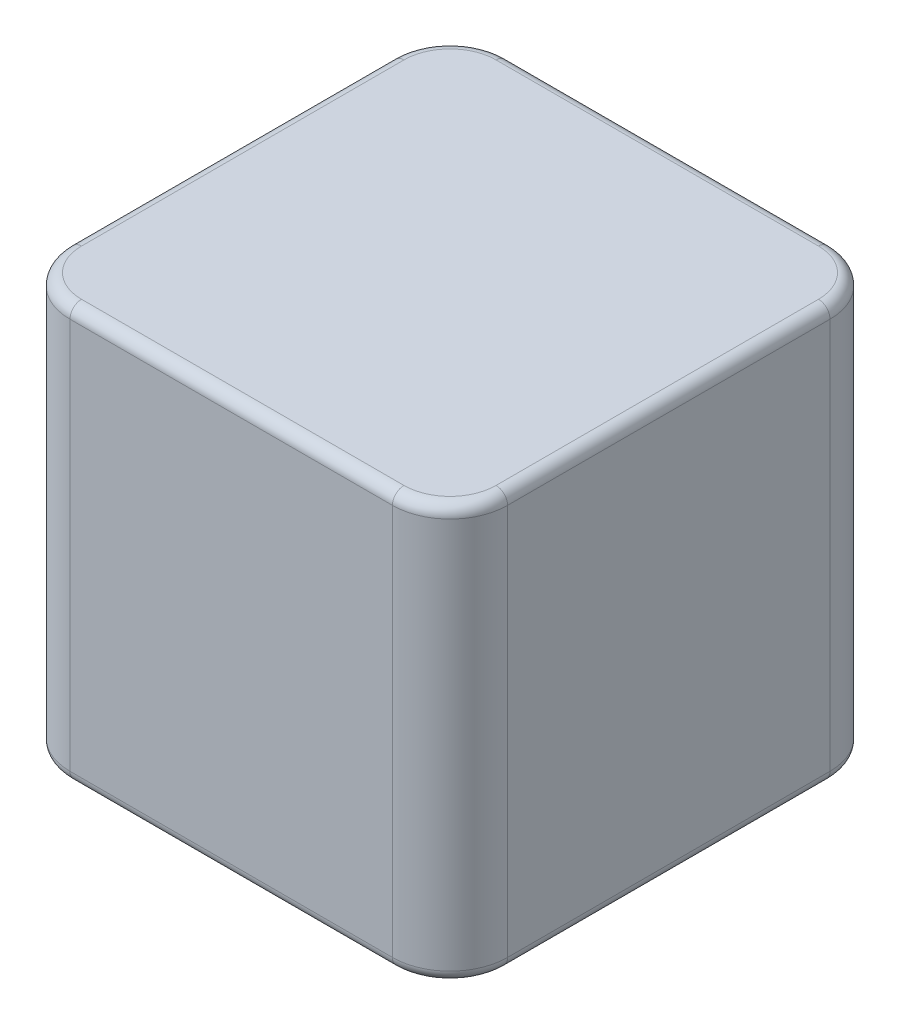
from build123d import *

# Parameters (mm, degrees)
SKETCH1_W           = 38
SKETCH1_H           = 38
BOSS_EXTRUDE1_DEPTH = 36
SKETCH3_R           = 7
CUT_EXTRUDE1_DEPTH  = 2
FILLET1_R           = 5
FILLET2_R           = 1


with BuildPart() as part:
    # Sketch1 → Boss-Extrude1 (new body)
    with BuildSketch(Plane(origin=(0, 0, 0), x_dir=(1, 0, 0), z_dir=(0, 1, 0))):
        Rectangle(SKETCH1_W, SKETCH1_H)
    extrude(amount=BOSS_EXTRUDE1_DEPTH)

    # Sketch3 → Cut-Extrude1 (cut)
    with BuildSketch(Plane.XZ):
        Circle(SKETCH3_R)
    extrude(amount=-CUT_EXTRUDE1_DEPTH, mode=Mode.SUBTRACT)

    # Fillet1
    fillet1_edges = [part.edges().sort_by_distance(p)[0] for p in [
        (19, 18, -19),
        (19, 18, 19),
        (-19, 18, -19),
        (-19, 18, 19),
    ]]
    fillet(fillet1_edges, radius=FILLET1_R)

    # Fillet2
    fillet2_edges = [part.edges().sort_by_distance(p)[0] for p in [
        (-17.535533906, 0, 17.535533906),
        (-19, 0, 0),
        (-17.535533906, 0, -17.535533906),
        (0, 0, -19),
        (17.535533906, 0, -17.535533906),
        (19, 0, 0),
        (17.535533906, 0, 17.535533906),
        (-17.535533906, 36, 17.535533906),
        (-19, 36, 0),
        (-17.535533906, 36, -17.535533906),
        (0, 36, -19),
        (17.535533906, 36, -17.535533906),
        (19, 36, 0),
        (17.535533906, 36, 17.535533906),
        (0, 0, 19),
        (0, 36, 19),
    ]]
    fillet(fillet2_edges, radius=FILLET2_R)


solid = part.part
